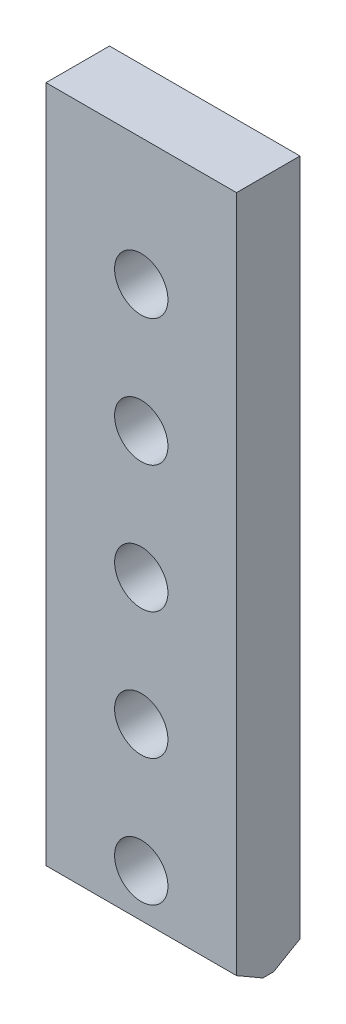
from build123d import *

# Parameters (mm, degrees)
SKETCH_1_W          = 75
SKETCH_1_H          = 273
EXTRUDE_1_DEPTH     = 25
SKETCH_2_R          = 10.5
CUT_EXTRUDE_1_DEPTH = 285.2164668
CHAMFER_1_SIZE      = 6
CHAMFER_1_SIZE2     = 10.392304845
CHAMFER_2_SIZE      = 6
CHAMFER_2_SIZE2     = 10.392304845


with BuildPart() as part:
    # Эскиз1 → Бобышка-Вытянуть1 (new body)
    with BuildSketch(Plane.XY):
        with Locations((37.5, 136.5)):
            Rectangle(SKETCH_1_W, SKETCH_1_H)
    extrude(amount=EXTRUDE_1_DEPTH)

    # Эскиз2 → Вырез-Вытянуть1 (cut, through all)
    with BuildSketch(Plane.XY.offset(25)):
        with Locations((37.5, 23)):
            Circle(SKETCH_2_R)
        with Locations((37.5, 73)):
            Circle(SKETCH_2_R)
        with Locations((37.5, 123)):
            Circle(SKETCH_2_R)
        with Locations((37.5, 173)):
            Circle(SKETCH_2_R)
        with Locations((37.5, 223)):
            Circle(SKETCH_2_R)
    extrude(amount=-CUT_EXTRUDE_1_DEPTH, mode=Mode.SUBTRACT)

    # Фаска1
    chamfer_1_edges = [part.edges().sort_by_distance(p)[0] for p in [
        (37.5, 0, 0),
    ]]
    chamfer_1_side = [part.faces().sort_by_distance(p)[0] for p in [
        (37.5, 137.747350693, 0),
    ]]
    chamfer(chamfer_1_edges, length=CHAMFER_1_SIZE, length2=CHAMFER_1_SIZE2, reference=chamfer_1_side[0])

    # Фаска2
    chamfer_2_edges = [part.edges().sort_by_distance(p)[0] for p in [
        (37.5, 0, 25),
    ]]
    chamfer_2_side = [part.faces().sort_by_distance(p)[0] for p in [
        (37.5, 137.747350693, 25),
    ]]
    chamfer(chamfer_2_edges, length=CHAMFER_2_SIZE, length2=CHAMFER_2_SIZE2, reference=chamfer_2_side[0])


solid = part.part
